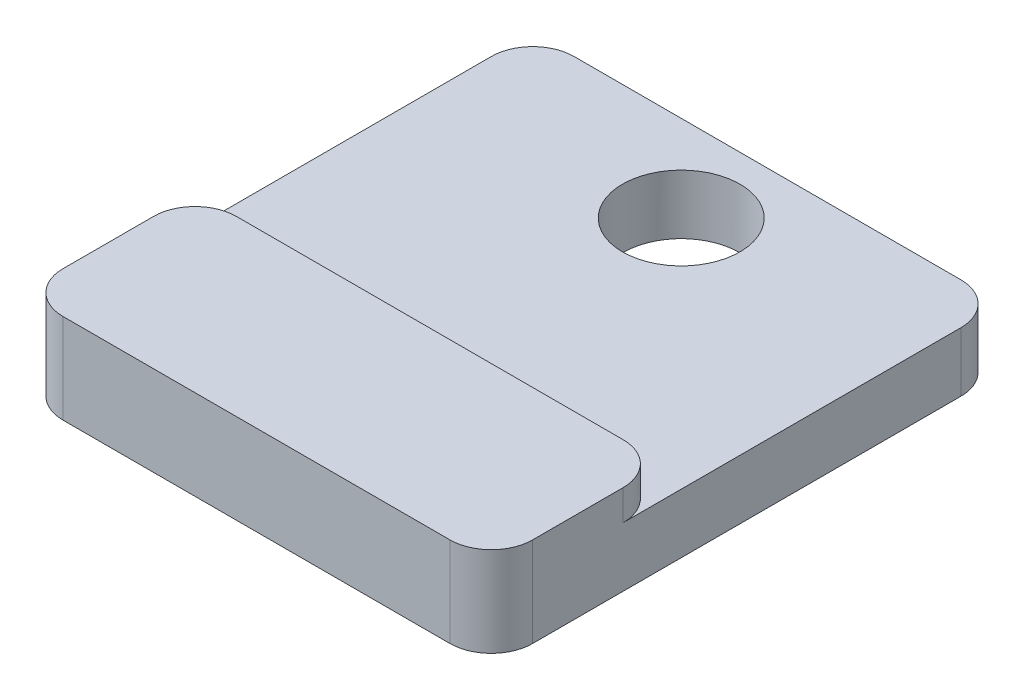
from build123d import *

# Parameters (mm, degrees)
SKETCH1_W           = 215.9
SKETCH1_H           = 234.95
BOSS_EXTRUDE1_DEPTH = 41.275
FILLET1_R           = 19.05
CUT_EXTRUDE1_REACH  = 323.742
SKETCH3_R           = 26.9875
CUT_EXTRUDE2_DEPTH  = 13.97
FILLET2_R           = 19.05


with BuildPart() as part:
    # Sketch1 → Boss-Extrude1 (new body)
    with BuildSketch(Plane(origin=(0, 0, 0), x_dir=(1, 0, 0), z_dir=(0, 1, 0))):
        with Locations((107.95, 117.475)):
            Rectangle(SKETCH1_W, SKETCH1_H)
    extrude(amount=BOSS_EXTRUDE1_DEPTH)

    # Fillet1
    fillet1_edges = [part.edges().sort_by_distance(p)[0] for p in [
        (0, 20.6375, -234.95),
        (215.9, 20.6375, -234.95),
        (215.9, 20.6375, 0),
        (0, 20.6375, 0),
    ]]
    fillet(fillet1_edges, radius=FILLET1_R)

    # Sketch3 → Cut-Extrude1 (cut, up to next)
    with BuildSketch(Plane(origin=(0, 41.275, 0), x_dir=(1, 0, 0), z_dir=(0, 1, 0)), mode=Mode.PRIVATE) as cut_extrude1_sk1:
        with Locations((107.95, 195.2625)):
            Circle(SKETCH3_R)
    cut_extrude1_tool1 = extrude(cut_extrude1_sk1.sketch, amount=-CUT_EXTRUDE1_REACH, mode=Mode.PRIVATE) & part.part
    add(cut_extrude1_tool1.solids().sort_by_distance((107.95, 41.275, -195.2625))[0], mode=Mode.SUBTRACT)

    # Sketch4 → Cut-Extrude2 (cut)
    with BuildSketch(Plane(origin=(0, 41.275, 0), x_dir=(1, 0, 0), z_dir=(0, 1, 0))):
        with BuildLine():
            Line((215.9, 79.6925), (0, 79.6925))
            Line((0, 79.6925), (0, 215.9))
            ThreePointArc((0, 215.9), (5.579615818, 229.370384182), (19.05, 234.95))
            Line((19.05, 234.95), (196.85, 234.95))
            ThreePointArc((196.85, 234.95), (210.320384182, 229.370384182), (215.9, 215.9))
            Line((215.9, 215.9), (215.9, 79.6925))
        make_face()
    extrude(amount=-CUT_EXTRUDE2_DEPTH, mode=Mode.SUBTRACT)

    # Fillet2
    fillet2_edges = [part.edges().sort_by_distance(p)[0] for p in [
        (0, 34.29, -79.6925),
        (215.9, 34.29, -79.6925),
    ]]
    fillet(fillet2_edges, radius=FILLET2_R)


solid = part.part
